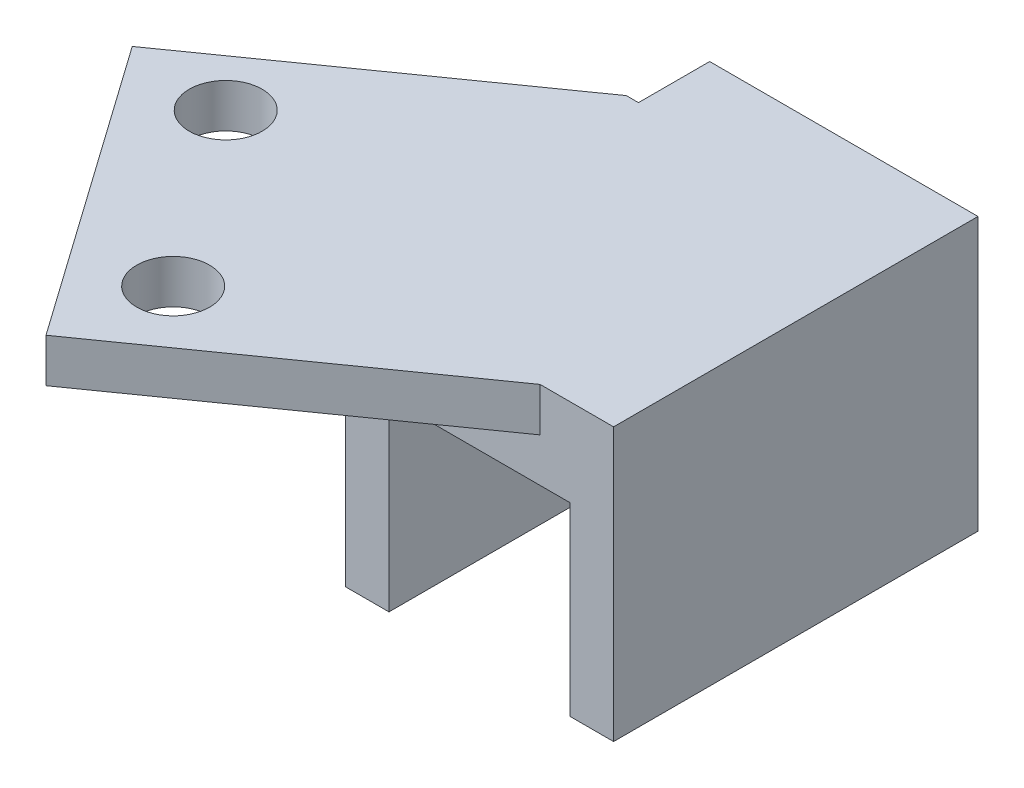
from build123d import *

# Parameters (mm, degrees)
BOSS_EXTRUDE1_DEPTH = 50
SKETCH3_R           = 5
BOSS_EXTRUDE2_DEPTH = 6


with BuildPart() as part:
    # Sketch1 → Boss-Extrude1 (new body)
    with BuildSketch(Plane.XY):
        Polygon((-18.408045977, 18.7), (-18.408045977, -12.7), (-12.408045977, -12.7), (-12.408045977, 12.7), (12.408045977, 12.7), (12.408045977, -12.7), (18.408045977, -12.7), (18.408045977, 18.7), align=None)
    extrude(amount=BOSS_EXTRUDE1_DEPTH)

    # Sketch3 → Boss-Extrude2 (add)
    with BuildSketch(Plane(origin=(0, 18.7, 0), x_dir=(1, 0, 0), z_dir=(0, 1, 0))):
        Polygon((-31.416615866, -78.051441911), (8.322327628, -50), (18.408045977, -50), (18.408045977, 0), (-18.408045977, 0), (-18.408045977, -9.767603477), (-20.077439321, -9.767603477), (-59.816382815, -37.819045388), align=None)
        with Locations((-28.523789581, -63.495410714)):
            Circle(SKETCH3_R, mode=Mode.SUBTRACT)
        with Locations((-45.824459622, -38.98649772)):
            Circle(SKETCH3_R, mode=Mode.SUBTRACT)
    extrude(amount=BOSS_EXTRUDE2_DEPTH)


solid = part.part
